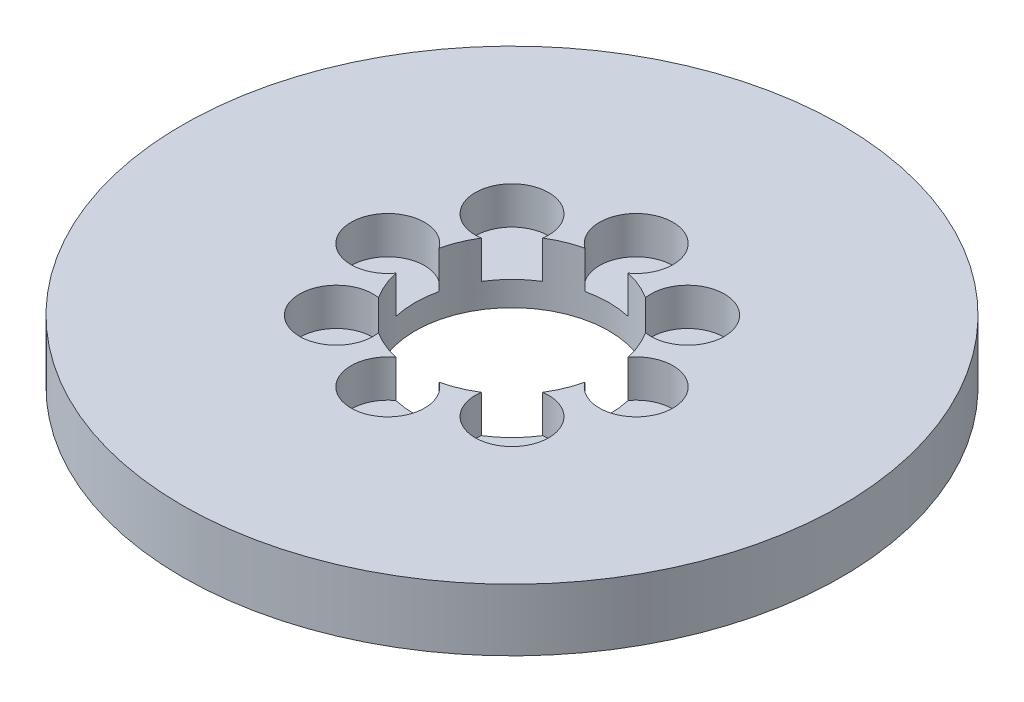
from build123d import *

# Parameters (mm, degrees)
SKETCH1_R           = 85
BOSS_EXTRUDE1_DEPTH = 16
SKETCH2_R           = 25
CUT_EXTRUDE1_DEPTH  = 122.268297588
SKETCH3_R           = 9.481924854
CUT_EXTRUDE2_DEPTH  = 9.673009817
CIRPATTERN1_COUNT   = 8


with BuildPart() as part:
    # Sketch1 → Boss-Extrude1 (new body)
    with BuildSketch(Plane(origin=(0, 0, 0), x_dir=(1, 0, 0), z_dir=(0, 1, 0))):
        Circle(SKETCH1_R)
    extrude(amount=BOSS_EXTRUDE1_DEPTH)

    # Sketch2 → Cut-Extrude1 (cut, through all)
    with BuildSketch(Plane(origin=(0, 0, 0), x_dir=(1, 0, 0), z_dir=(0, 1, 0))):
        Circle(SKETCH2_R)
    extrude(amount=CUT_EXTRUDE1_DEPTH, mode=Mode.SUBTRACT)

    # Sketch3 → Cut-Extrude2 (cut)
    with BuildSketch(Plane(origin=(0, 16, 0), x_dir=(1, 0, 0), z_dir=(0, 1, 0))):
        with Locations((-32.030995335, 0)):
            Circle(SKETCH3_R)
    cut_extrude2 = extrude(amount=-CUT_EXTRUDE2_DEPTH, mode=Mode.SUBTRACT)

    # CirPattern1: Cut-Extrude2 ×8 about axis
    cirpattern1_axis = Axis((0, 0, 0), (0, 1, 0))
    for i in range(1, CIRPATTERN1_COUNT):
        add(cut_extrude2.rotate(cirpattern1_axis, i * 360 / CIRPATTERN1_COUNT), mode=Mode.SUBTRACT)


solid = part.part
